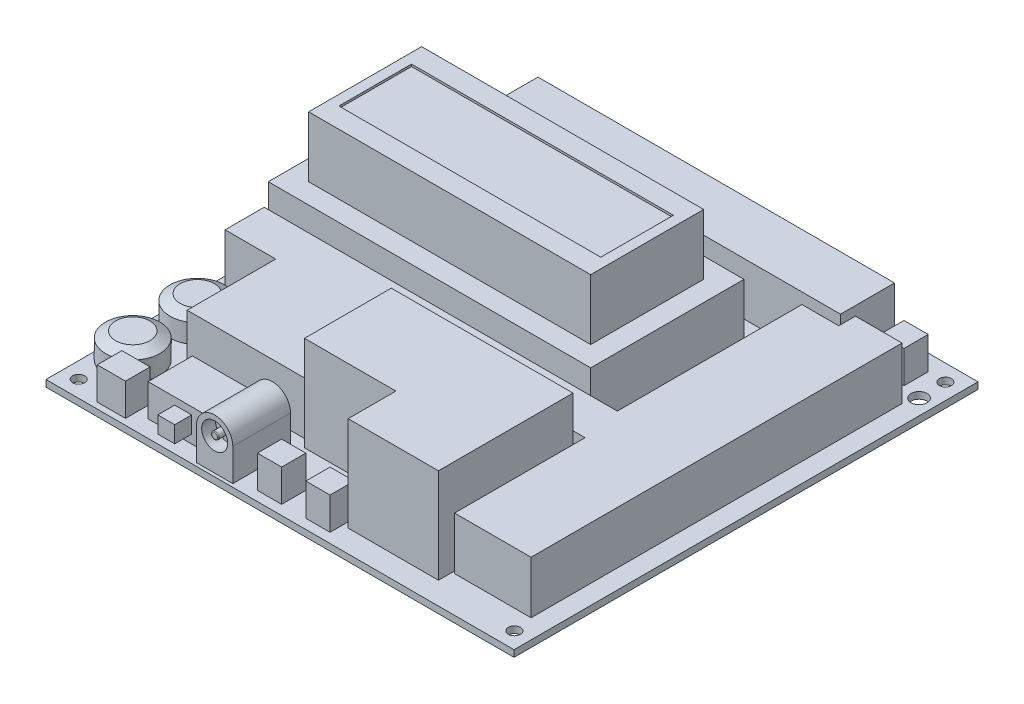
from build123d import *
from OCP.BRepFilletAPI import BRepFilletAPI_MakeChamfer

# Parameters (mm, degrees)
SKETCH1_W              = 116
SKETCH1_H              = 115
SKETCH1_R              = 1.5
BASE_FLANGE1_DEPTH     = 1.65
SKETCH3_W              = 79.9
SKETCH3_H              = 38
EXTRUDE1_DEPTH         = 15
SKETCH4_W              = 69.9
SKETCH4_H              = 28
EXTRUDE2_DEPTH         = 15
SKETCH6_W              = 64.9
SKETCH6_H              = 18
DISPLAY_DEPTH          = 0.53
SKETCH7_W              = 91
SKETCH7_H              = 60
WIRING_BOARD_DEPTH     = 15
SKETCH8_W              = 7
SKETCH8_H              = 20
EXTRUDE5_DEPTH         = 7.5
SKETCH9_W              = 10.5
SKETCH9_H              = 8.5
SKETCH9_W_2            = 5.5
SKETCH9_H_2            = 3.5
USB_DEPTH              = 7.5
CHAMFER1_SIZE          = 2
SKETCH10_R             = 6.75
POTENTIOMETERS_DEPTH   = 6.2
SKETCH11_W             = 7
SKETCH11_H             = 6.1
SKETCH11_W_2           = 9
SKETCH11_H_2           = 14.3
SKETCH11_W_3           = 6
SKETCH11_H_3           = 6
SKETCH11_W_4           = 2
SKETCH11_H_4           = 5
KEEP_ACCESSIBLE_DEPTH  = 8
EXTRUDE9_DEPTH         = 13
HOT_VOLTAGE_REGS_DEPTH = 23.5
SKETCH14_R             = 4.5
EXTRUDE10_DEPTH        = 14.3
EXTRUDE11_DEPTH        = 10
EXTRUDE11_DEPTH_BACK   = 3.4
SKETCH15_R             = 3.219788924
SKETCH15_R_2           = 0.896300673
SKETCH15_W             = 5.949829442
SKETCH15_H             = 2.638553101
SKETCH15_H_2           = 2.133019186
FILLET1_R              = 0.2
CHAMFER2_SIZE          = 1.5
CHAMFER2_SIZE2         = 2.5
SKETCH16_R             = 2
EXTRUDE12_DEPTH        = 10


# Sheet-metal steps are written as plain solids
with BuildPart() as part:
    # Sketch1 → Base-Flange1 (new body)
    with BuildSketch(Plane(origin=(0, 0, 0), x_dir=(1, 0, 0), z_dir=(0, 1, 0))):
        Rectangle(SKETCH1_W, SKETCH1_H)
        with Locations(Location((54, 53.4, 0), (0, 0, 270))):
            Circle(SKETCH1_R, mode=Mode.SUBTRACT)
        with Locations(Location((54, -53.4, 0), (0, 0, 90))):
            Circle(SKETCH1_R, mode=Mode.SUBTRACT)
        with Locations(Location((-54, 53.4, 0), (0, 0, 90))):
            Circle(SKETCH1_R, mode=Mode.SUBTRACT)
        with Locations(Location((-54, -53.4, 0), (0, 0, 270))):
            Circle(SKETCH1_R, mode=Mode.SUBTRACT)
    extrude(amount=BASE_FLANGE1_DEPTH)

    # Sketch3 → Extrude1 (add)
    with BuildSketch(Plane(origin=(0, 1.65, 0), x_dir=(1, 0, 0), z_dir=(0, 1, 0))):
        with Locations((-17.95, 16.5)):
            Rectangle(SKETCH3_W, SKETCH3_H)
    extrude(amount=EXTRUDE1_DEPTH)

    # Sketch4 → Extrude2 (add)
    with BuildSketch(Plane(origin=(0, 16.65, 0), x_dir=(1, 0, 0), z_dir=(0, 1, 0))):
        with Locations((-17.95, 16.5)):
            Rectangle(SKETCH4_W, SKETCH4_H)
    extrude(amount=EXTRUDE2_DEPTH)

    # Sketch6 → Display! (cut)
    with BuildSketch(Plane(origin=(0, 31.65, 0), x_dir=(1, 0, 0), z_dir=(0, 1, 0))):
        with Locations((-17.95, 16.5)):
            Rectangle(SKETCH6_W, SKETCH6_H)
    extrude(amount=-DISPLAY_DEPTH, mode=Mode.SUBTRACT)

    # Sketch7 → Wiring Board (add)
    with BuildSketch(Plane.XZ):
        with Locations((-12.4, -9.5)):
            Rectangle(SKETCH7_W, SKETCH7_H)
    extrude(amount=WIRING_BOARD_DEPTH)

    # Sketch8 → Extrude5 (add)
    with BuildSketch(Plane.XZ.offset(15)):
        with Locations((-40.4, -0.8)):
            Rectangle(SKETCH8_W, SKETCH8_H)
    extrude(amount=EXTRUDE5_DEPTH)

    # Sketch9 → USB (cut)
    with BuildSketch(Plane.ZY.offset(58)):
        with Locations((-24.25, -7.35)):
            Rectangle(SKETCH9_W, SKETCH9_H)
        with Locations((-24.25, -7.35)):
            Rectangle(SKETCH9_W_2, SKETCH9_H_2, mode=Mode.SUBTRACT)
    extrude(amount=-USB_DEPTH, mode=Mode.SUBTRACT)

    # Chamfer1
    chamfer1_edges = [part.edges().sort_by_distance(p)[0] for p in [
        (-54.2, -3.1, -19),
        (-54.2, -3.1, -29.5),
    ]]
    chamfer(chamfer1_edges, length=CHAMFER1_SIZE)

    # Sketch10 → Potentiometers (add)
    with BuildSketch(Plane(origin=(0, 1.65, 0), x_dir=(1, 0, 0), z_dir=(0, 1, 0))):
        with Locations(Location((-51.5, -26.5, 0), (0, 0, 164.357528987))):
            Circle(SKETCH10_R)
        with Locations(Location((-51.5, -42.5, 0), (0, 0, 164.357528987))):
            Circle(SKETCH10_R)
    extrude(amount=POTENTIOMETERS_DEPTH)

    # Sketch11 → Keep Accessible!! (add)
    with BuildSketch(Plane(origin=(0, 1.65, 0), x_dir=(1, 0, 0), z_dir=(0, 1, 0))):
        Polygon((-26.092034571, -53.3), (-23.1, -53.3), (-23.1, -42.3), (-36.9, -42.3), (-36.9, -53.3), (-30.292034571, -53.3), (-30.292034571, -57.5), (-26.092034571, -57.5), align=None)
        with Locations((-43.3, -52.95)):
            Rectangle(SKETCH11_W, SKETCH11_H)
        with Locations((-17, -49.55)):
            Rectangle(SKETCH11_W_2, SKETCH11_H_2)
        with Locations((-5, -52.1)):
            Rectangle(SKETCH11_W_3, SKETCH11_H_3)
        with Locations((7, -52.1)):
            Rectangle(SKETCH11_W_3, SKETCH11_H_3)
        with Locations((46.66, 50.5)):
            Rectangle(SKETCH11_W_3, SKETCH11_H_3)
        with Locations((-54.82, 45.3)):
            Rectangle(SKETCH11_W_4, SKETCH11_H_4)
        with Locations((-52.52, 45.3)):
            Rectangle(SKETCH11_W_4, SKETCH11_H_4)
    extrude(amount=KEEP_ACCESSIBLE_DEPTH)

    # Sketch12 → Extrude9 (add)
    with BuildSketch(Plane(origin=(0, 1.65, 0), x_dir=(1, 0, 0), z_dir=(0, 1, 0))):
        Polygon((-48.948570669, 53.670290093), (-48.948570669, 44.832154672), (-35.833918109, 44.832154672), (-35.833918109, 41.981143246), (37.294524965, 41.981143246), (39.432783534, 41.981143246), (39.432783534, 53.670290093), (39.432783534, 55.380896948), (-48.948570669, 55.380896948), align=None)
        Polygon((41.713592675, 43.406648959), (41.713592675, 39.272682392), (32.590356112, 39.272682392), (32.590356112, -6.486050994), (-54.935694663, -6.486050994), (-54.935694663, -16.179489842), (-42.391244389, -16.179489842), (-42.391244389, -38.132277821), (-13.310927845, -38.132277821), (-13.310927845, -16.179489842), (34.300962968, -16.179489842), (34.300962968, -48.538469526), (53.26018895, -48.538469526), (53.26018895, 43.406648959), align=None)
    extrude(amount=EXTRUDE9_DEPTH)

    # Sketch13 → Hot! Voltage Regs (add)
    with BuildSketch(Plane(origin=(0, 1.65, 0), x_dir=(1, 0, 0), z_dir=(0, 1, 0))):
        Polygon((-11.315219847, -18.602849554), (-11.315219847, -40.12798582), (11.350320989, -40.12798582), (11.350320989, -51.959683237), (33.730760683, -51.959683237), (33.730760683, -18.602849554), align=None)
    extrude(amount=HOT_VOLTAGE_REGS_DEPTH)

    # Sketch14 → Extrude10 (add)
    with BuildSketch(Plane.XY.offset(56.7)):
        with Locations((-17, 9.65)):
            Circle(SKETCH14_R)
    extrude(amount=-EXTRUDE10_DEPTH)

    # Sketch15 → Extrude11 (cut, two sides: drawn at the far end of the back side and taken through both)
    # profile 1 of 3: a face of its own
    with BuildSketch(Plane.XY.offset(56.7).offset(-EXTRUDE11_DEPTH_BACK)):
        with Locations(Location((-17, 9.65, 0), (0, 0, 180))):
            Circle(SKETCH15_R)
        with Locations(Location((-17, 9.65, 0), (0, 0, 180))):
            Circle(SKETCH15_R_2, mode=Mode.SUBTRACT)
    # profile 2 of 3: a face of its own
    with BuildSketch(Plane.XY.offset(56.7).offset(-EXTRUDE11_DEPTH_BACK)):
        with Locations((-28.188847243, 9.227024123)):
            Rectangle(SKETCH15_W, SKETCH15_H)
    # profile 3 of 3: a face of its own
    with BuildSketch(Plane.XY.offset(56.7).offset(-EXTRUDE11_DEPTH_BACK)):
        with Locations((-28.188847243, 2.716509593)):
            Rectangle(SKETCH15_W, SKETCH15_H_2)
    extrude(amount=EXTRUDE11_DEPTH + EXTRUDE11_DEPTH_BACK, mode=Mode.SUBTRACT)

    # Fillet1
    fillet1_edges = [part.edges().sort_by_distance(p)[0] for p in [
        (-16.103699327, 9.65, 56.7),
        (-57.9, -9.1, -24.25),
        (-57.9, -7.35, -21.5),
        (-57.9, -5.6, -24.25),
        (-57.9, -7.35, -27),
    ]]
    fillet(fillet1_edges, radius=FILLET1_R)

    # Chamfer2: one chamfer whose edges measure the first distance from different faces: ONE call of the kernel's chamfer builder (chamfer() names one face for all edges)
    chamfer2_edges_1 = [part.edges().sort_by_distance(p)[0] for p in [
        (-45, 7.85, 28.320027472),
    ]]
    chamfer2_side_1 = [part.faces().sort_by_distance(p)[0] for p in [
        (-45, 4.75, 28.320027472),
    ]]
    chamfer2_edges_2 = [part.edges().sort_by_distance(p)[0] for p in [
        (-45, 7.85, 44.320027472),
    ]]
    chamfer2_side_2 = [part.faces().sort_by_distance(p)[0] for p in [
        (-45, 4.75, 44.320027472),
    ]]
    chamfer2 = BRepFilletAPI_MakeChamfer(part.part.solid().wrapped)
    for e in chamfer2_edges_1:
        chamfer2.Add(CHAMFER2_SIZE, CHAMFER2_SIZE2, e.wrapped, chamfer2_side_1[0].wrapped)  # the first distance lies on this face
    for e in chamfer2_edges_2:
        chamfer2.Add(CHAMFER2_SIZE, CHAMFER2_SIZE2, e.wrapped, chamfer2_side_2[0].wrapped)  # the first distance lies on this face
    add(Compound.cast(chamfer2.Shape()), mode=Mode.REPLACE)

    # Sketch16 → Extrude12 (cut)
    with BuildSketch(Plane(origin=(0, 1.65, 0), x_dir=(1, 0, 0), z_dir=(0, 1, 0))):
        with Locations(Location((54.2, 46.7, 0), (0, 0, 270))):
            Circle(SKETCH16_R)
    extrude(amount=-EXTRUDE12_DEPTH, mode=Mode.SUBTRACT)


solid = part.part
